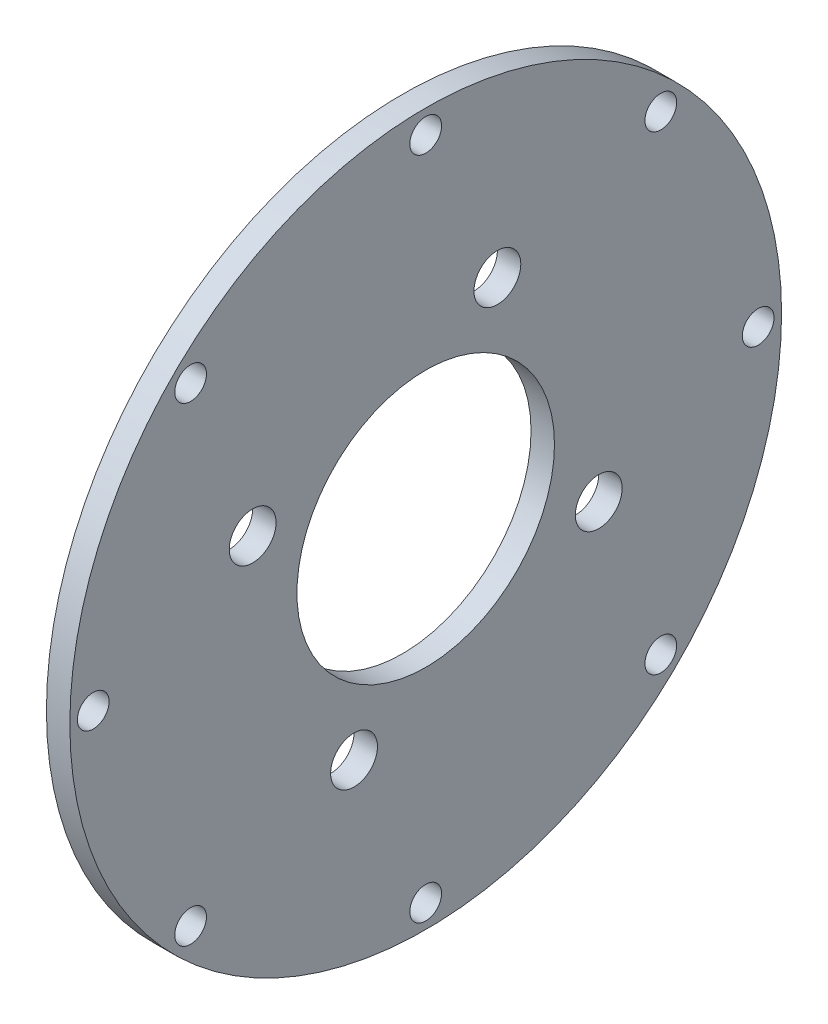
from build123d import *

# Parameters (mm, degrees)
SKETCH1_R           = 48.26
SKETCH1_R_2         = 2.15265
SKETCH1_R_3         = 17.4625
SKETCH1_R_4         = 3.175
BOSS_EXTRUDE1_DEPTH = 3.175


with BuildPart() as part:
    # Sketch1 → Boss-Extrude1 (new body)
    with BuildSketch(Plane(origin=(0, 0, 0), x_dir=(0, 0, -1), z_dir=(1, 0, 0))):
        Circle(SKETCH1_R)
        with Locations((0, 45.085)):
            Circle(SKETCH1_R_2, mode=Mode.SUBTRACT)
        with Locations((31.87990923, 31.87990923)):
            Circle(SKETCH1_R_2, mode=Mode.SUBTRACT)
        with Locations((45.085, 0)):
            Circle(SKETCH1_R_2, mode=Mode.SUBTRACT)
        with Locations((31.87990923, -31.87990923)):
            Circle(SKETCH1_R_2, mode=Mode.SUBTRACT)
        with Locations((0, -45.085)):
            Circle(SKETCH1_R_2, mode=Mode.SUBTRACT)
        with Locations((-31.87990923, -31.87990923)):
            Circle(SKETCH1_R_2, mode=Mode.SUBTRACT)
        with Locations((-45.085, 0)):
            Circle(SKETCH1_R_2, mode=Mode.SUBTRACT)
        with Locations((-31.87990923, 31.87990923)):
            Circle(SKETCH1_R_2, mode=Mode.SUBTRACT)
        Circle(SKETCH1_R_3, mode=Mode.SUBTRACT)
        with Locations((9.720159182, 23.466540126)):
            Circle(SKETCH1_R_4, mode=Mode.SUBTRACT)
        with Locations((23.466540126, -9.720159182)):
            Circle(SKETCH1_R_4, mode=Mode.SUBTRACT)
        with Locations((-9.720159182, -23.466540126)):
            Circle(SKETCH1_R_4, mode=Mode.SUBTRACT)
        with Locations((-23.466540126, 9.720159182)):
            Circle(SKETCH1_R_4, mode=Mode.SUBTRACT)
    extrude(amount=BOSS_EXTRUDE1_DEPTH)


solid = part.part
